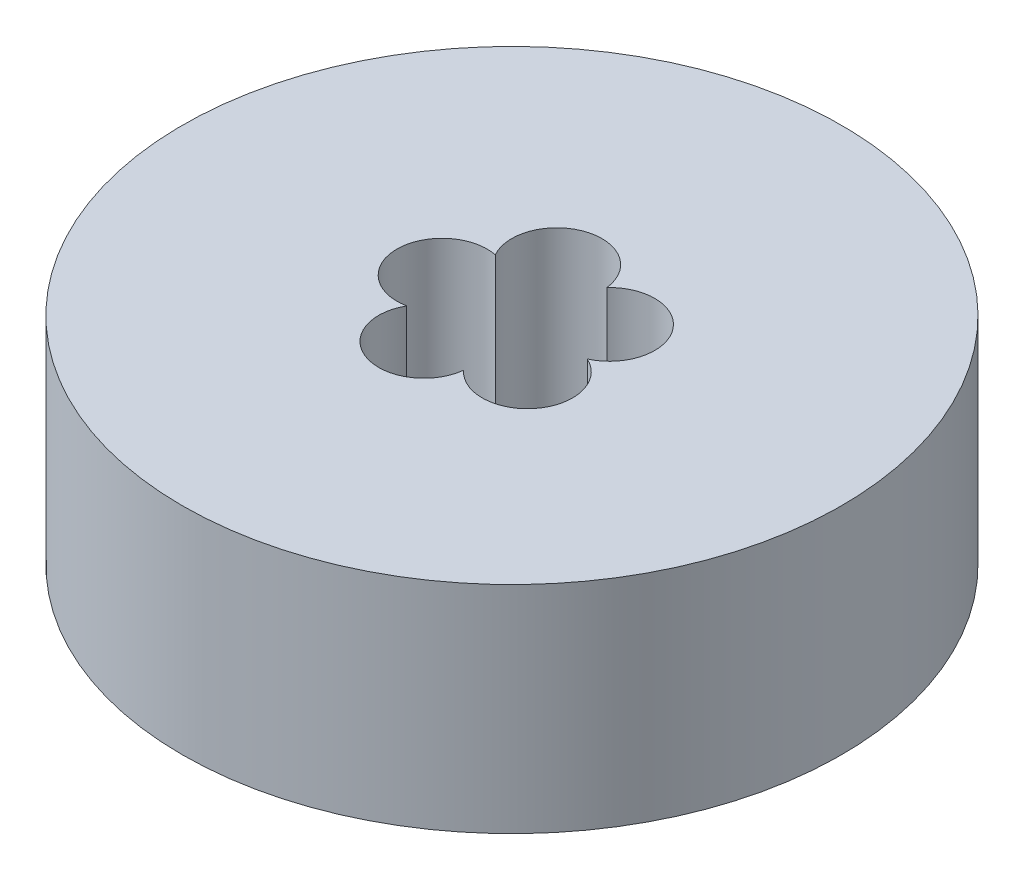
from build123d import *

# Parameters (mm, degrees)
SKETCH1_R           = 27.5
BOSS_EXTRUDE1_DEPTH = 18
SKETCH2_R           = 5
CUT_EXTRUDE1_DEPTH  = 43.854404674
SKETCH3_R           = 3.769575295
CUT_EXTRUDE2_DEPTH  = 15.258814729
CIRPATTERN1_COUNT   = 5


with BuildPart() as part:
    # Sketch1 → Boss-Extrude1 (new body)
    with BuildSketch(Plane(origin=(0, 0, 0), x_dir=(1, 0, 0), z_dir=(0, 1, 0))):
        Circle(SKETCH1_R)
    extrude(amount=BOSS_EXTRUDE1_DEPTH)

    # Sketch2 → Cut-Extrude1 (cut, through all)
    with BuildSketch(Plane(origin=(0, 0, 0), x_dir=(1, 0, 0), z_dir=(0, 1, 0))):
        Circle(SKETCH2_R)
    extrude(amount=CUT_EXTRUDE1_DEPTH, mode=Mode.SUBTRACT)

    # Sketch3 → Cut-Extrude2 (cut)
    with BuildSketch(Plane(origin=(0, 18, 0), x_dir=(1, 0, 0), z_dir=(0, 1, 0))):
        with Locations((-5.832726886, 0)):
            Circle(SKETCH3_R)
    cut_extrude2 = extrude(amount=-CUT_EXTRUDE2_DEPTH, mode=Mode.SUBTRACT)

    # CirPattern1: Cut-Extrude2 ×5 about axis
    cirpattern1_axis = Axis((0, 0, 0), (0, 1, 0))
    for i in range(1, CIRPATTERN1_COUNT):
        add(cut_extrude2.rotate(cirpattern1_axis, i * 360 / CIRPATTERN1_COUNT), mode=Mode.SUBTRACT)


solid = part.part
